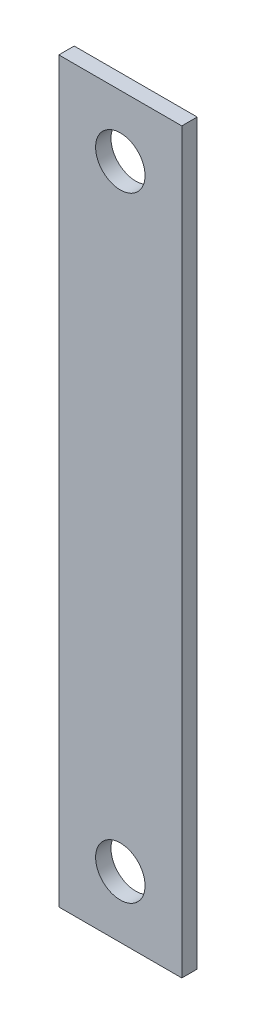
from build123d import *

# Parameters (mm, degrees)
SKETCH1_W              = 12.7
SKETCH1_H              = 76.2
BASE_FLANGE1_DEPTH     = 1.5875
F_10_CLEARANCE_HOLE1_D = 5.1054


# Sheet-metal steps are written as plain solids
with BuildPart() as part:
    # Sketch1 → Base-Flange1 (new body)
    with BuildSketch(Plane.XY):
        with Locations((6.35, 38.1)):
            Rectangle(SKETCH1_W, SKETCH1_H)
    extrude(amount=-BASE_FLANGE1_DEPTH)

    # #10 Clearance Hole1 (through all)
    with Locations(Plane.XY):
        with Locations((6.35, 69.85), (6.35, 6.35)):
            Hole(F_10_CLEARANCE_HOLE1_D / 2)


solid = part.part
